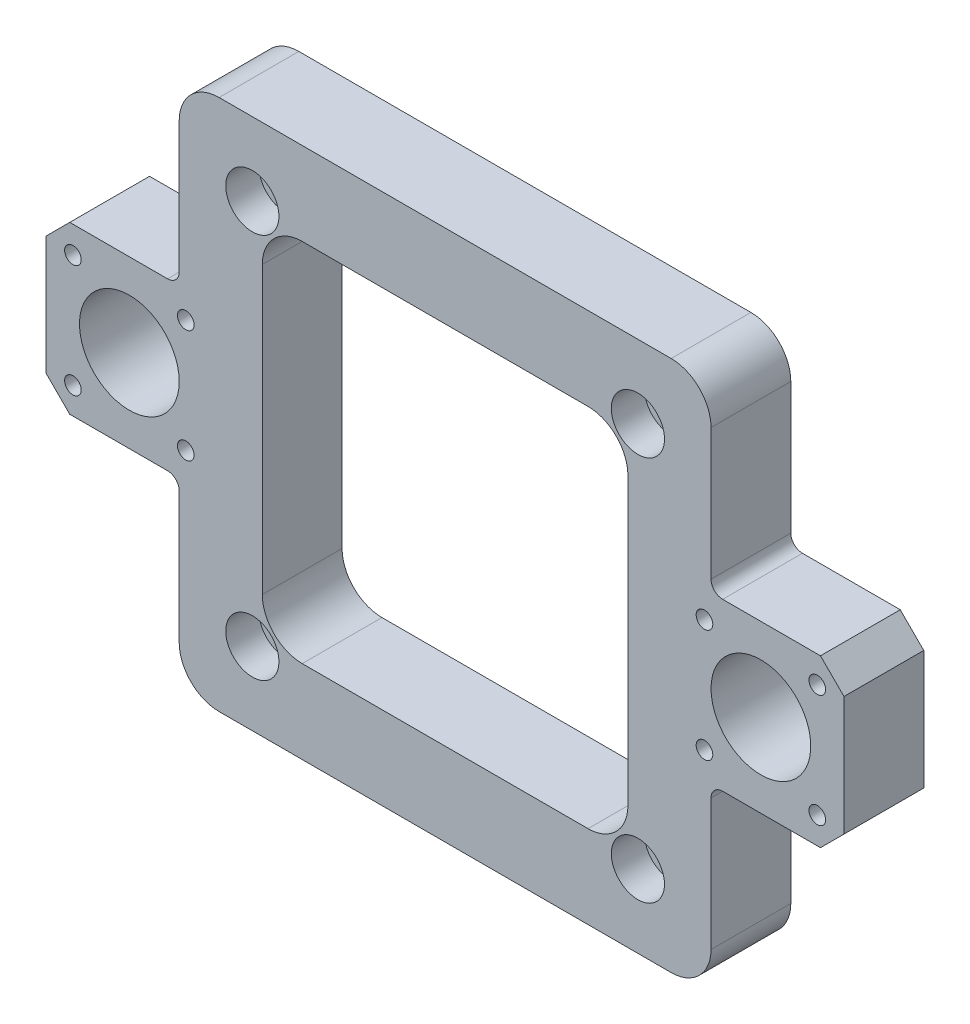
from build123d import *

# Parameters (mm, degrees)
SKETCH1_R                                           = 7.5
BOSS_EXTRUDE1_DEPTH                                 = 12
CUT_EXTRUDE1_DEPTH                                  = 74.10266753
CUT_EXTRUDE1_DEPTH_BACK                             = 74.10266753
TAP_DRILL_FOR_M3X0_5_TAP1_D                         = 2.5
CBORE_FOR_M4_HEX_SOCKET_HEAD_CAP_SCREW1_D           = 4.3
CBORE_FOR_M4_HEX_SOCKET_HEAD_CAP_SCREW1_CBORE_D     = 8
CBORE_FOR_M4_HEX_SOCKET_HEAD_CAP_SCREW1_CBORE_DEPTH = 5


with BuildPart() as part:
    # Sketch1 → Boss-Extrude1 (new body)
    with BuildSketch(Plane.XY):
        with BuildLine():
            Line((-56.464466094, 12.5), (-41.75, 12.5))
            ThreePointArc((-41.75, 12.5), (-40.512563133, 13.012563133), (-40, 14.25))
            Line((-40, 14.25), (-40, 34))
            ThreePointArc((-40, 34), (-38.242640687, 38.242640687), (-34, 40))
            Line((-34, 40), (34, 40))
            ThreePointArc((34, 40), (38.242640687, 38.242640687), (40, 34))
            Line((40, 34), (40, 14.25))
            ThreePointArc((40, 14.25), (40.512563133, 13.012563133), (41.75, 12.5))
            Line((41.75, 12.5), (56.464466094, 12.5))
            Line((56.464466094, 12.5), (60, 8.964466094))
            Line((60, 8.964466094), (60, -8.964466094))
            Line((60, -8.964466094), (56.464466094, -12.5))
            Line((56.464466094, -12.5), (41.75, -12.5))
            ThreePointArc((41.75, -12.5), (40.512563133, -13.012563133), (40, -14.25))
            Line((40, -14.25), (40, -34))
            ThreePointArc((40, -34), (38.242640687, -38.242640687), (34, -40))
            Line((34, -40), (-34, -40))
            ThreePointArc((-34, -40), (-38.242640687, -38.242640687), (-40, -34))
            Line((-40, -34), (-40, -14.25))
            ThreePointArc((-40, -14.25), (-40.512563133, -13.012563133), (-41.75, -12.5))
            Line((-41.75, -12.5), (-56.464466094, -12.5))
            Line((-56.464466094, -12.5), (-60, -8.964466094))
            Line((-60, -8.964466094), (-60, 8.964466094))
            Line((-60, 8.964466094), (-56.464466094, 12.5))
        make_face()
        with Locations((-47.5, 0)):
            Circle(SKETCH1_R, mode=Mode.SUBTRACT)
        with Locations((47.5, 0)):
            Circle(SKETCH1_R, mode=Mode.SUBTRACT)
    extrude(amount=BOSS_EXTRUDE1_DEPTH)

    # Sketch2 → Cut-Extrude1 (cut, two sides: drawn at the far end of the back side and taken through both)
    with BuildSketch(Plane.XY.offset(12).offset(-CUT_EXTRUDE1_DEPTH_BACK)):
        with BuildLine():
            Line((-21.5, 27.5), (21.5, 27.5))
            ThreePointArc((21.5, 27.5), (25.742640687, 25.742640687), (27.5, 21.5))
            Line((27.5, 21.5), (27.5, -21.5))
            ThreePointArc((27.5, -21.5), (25.742640687, -25.742640687), (21.5, -27.5))
            Line((21.5, -27.5), (-21.5, -27.5))
            ThreePointArc((-21.5, -27.5), (-25.742640687, -25.742640687), (-27.5, -21.5))
            Line((-27.5, -21.5), (-27.5, 21.5))
            ThreePointArc((-27.5, 21.5), (-25.742640687, 25.742640687), (-21.5, 27.5))
        make_face()
    extrude(amount=CUT_EXTRUDE1_DEPTH + CUT_EXTRUDE1_DEPTH_BACK, mode=Mode.SUBTRACT)

    # Tap Drill for M3x0.5 Tap1 (through all)
    with Locations(Plane(origin=(0, 0, 0), x_dir=(-1, 0, 0), z_dir=(0, 0, -1))):
        with Locations((55.985281374, -8.485281374), (55.985281374, 8.485281374), (39.014718626, 8.485281374), (39.014718626, -8.485281374), (-39.014718626, -8.485281374), (-39.014718626, 8.485281374), (-55.985281374, 8.485281374), (-55.985281374, -8.485281374)):
            Hole(TAP_DRILL_FOR_M3X0_5_TAP1_D / 2)

    # CBORE for M4 Hex Socket Head Cap Screw1 (through all)
    with Locations(Plane(origin=(0, 0, 12), x_dir=(-1, 0, 0), z_dir=(0, 0, 1))):
        with Locations((29, 29), (29, -29), (-29, -29), (-29, 29)):
            CounterBoreHole(CBORE_FOR_M4_HEX_SOCKET_HEAD_CAP_SCREW1_D / 2, CBORE_FOR_M4_HEX_SOCKET_HEAD_CAP_SCREW1_CBORE_D / 2, CBORE_FOR_M4_HEX_SOCKET_HEAD_CAP_SCREW1_CBORE_DEPTH)


solid = part.part
